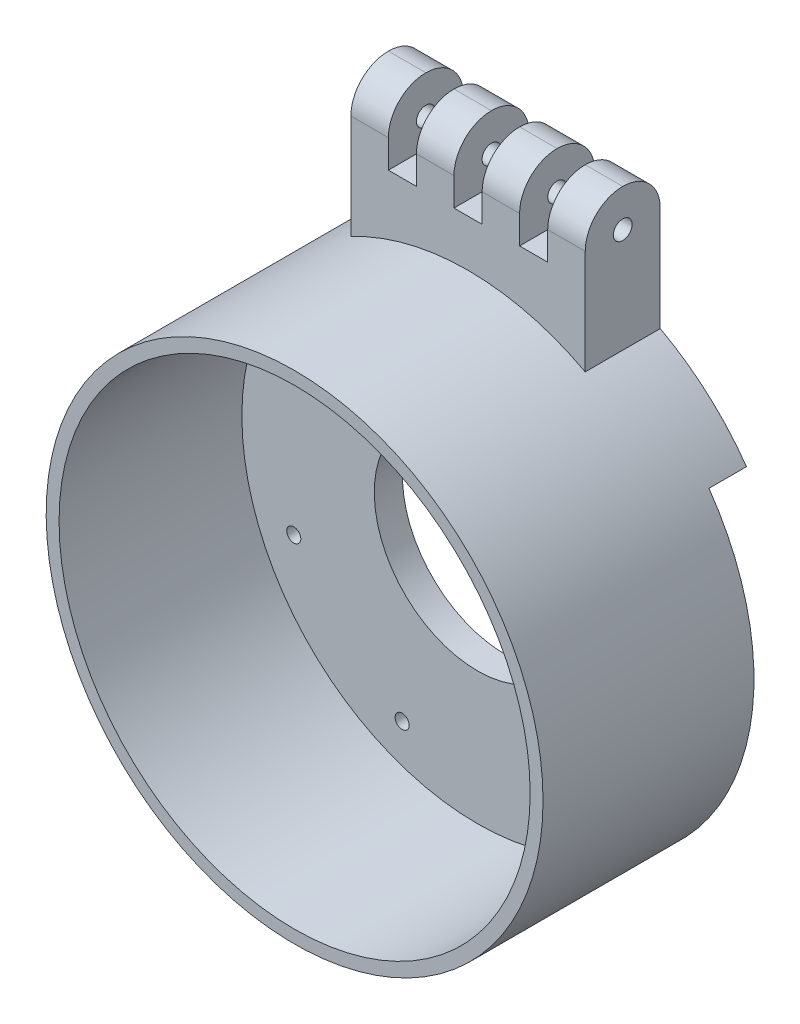
from build123d import *

# Parameters (mm, degrees)
SKETCH1_R               = 53
BOSS_EXTRUDE2_DEPTH     = 45
SKETCH2_R               = 50.25
CUT_EXTRUDE1_DEPTH      = 39
SKETCH4_R               = 22
CUT_EXTRUDE3_DEPTH      = 39
BOSS_EXTRUDE3_START     = 8
BOSS_EXTRUDE3_DEPTH     = 8
CUT_EXTRUDE5_DEPTH      = 10
CUT_EXTRUDE5_DEPTH_BACK = 10
SKETCH10_R              = 1.5
BOSS_EXTRUDE6_START     = -8
BOSS_EXTRUDE6_DEPTH     = 16
SKETCH13_W              = 8
SKETCH13_H              = 16
BOSS_EXTRUDE7_DEPTH     = 14
FILLET1_R               = 8
LPATTERN1_COUNT         = 4
LPATTERN1_PITCH         = 14
FILLET1_OF_LPATTERN1_R  = 8
CUT_EXTRUDE6_DEPTH      = 119.482066153
CUT_EXTRUDE6_DEPTH_BACK = 119.482066153
SKETCH14_R              = 2


# Read off the part's stored shape, not the designer's step: Boss-Extrude6
with BuildPart() as part:
    # Sketch1 → Boss-Extrude2 (new body)
    with BuildSketch(Plane.XY):
        with Locations(Location((0, 0, 0), (0, 0, 180))):
            Circle(SKETCH1_R)
    extrude(amount=BOSS_EXTRUDE2_DEPTH)

    # Sketch2 → Cut-Extrude1 (cut)
    with BuildSketch(Plane.XY.offset(45)):
        Circle(SKETCH2_R)
    extrude(amount=-CUT_EXTRUDE1_DEPTH, mode=Mode.SUBTRACT)

    # Sketch4 → Cut-Extrude3 (cut)
    with BuildSketch(Plane(origin=(0, 0, 0), x_dir=(-1, 0, 0), z_dir=(0, 0, -1))):
        Circle(SKETCH4_R)
    extrude(amount=-CUT_EXTRUDE3_DEPTH, mode=Mode.SUBTRACT)

    # Sketch5 → Boss-Extrude3 (add)
    with BuildSketch(Plane(origin=(0, 0, 0), x_dir=(-1, 0, 0), z_dir=(0, 0, -1)).offset(BOSS_EXTRUDE3_START)):
        with BuildLine():
            Line((19.052558883, 11), (51.845925587, 11))
            ThreePointArc((51.845925587, 11), (10.588828865, 51.931461594), (-43.400241675, 30.42070056))
            Line((-43.400241675, 30.42070056), (-16.397830673, 14.666667965))
            ThreePointArc((-16.397830673, 14.666667965), (2.263406494, 21.883258236), (19.052558883, 11))
        make_face()
    extrude(amount=-BOSS_EXTRUDE3_DEPTH)

    # Sketch10 → Cut-Extrude5 (cut, two sides: drawn at the far end of the back side and taken through both)
    with BuildSketch(Plane(origin=(0, 0, 0), x_dir=(-1, 0, 0), z_dir=(0, 0, -1)).offset(-CUT_EXTRUDE5_DEPTH_BACK)):
        with Locations(Location((-39.35, -16.057007816, 0), (0, 0, 180))):
            Circle(SKETCH10_R)
        with Locations(Location((-39.178670952, 16.470632727, 0), (0, 0, 180))):
            Circle(SKETCH10_R)
        with Locations(Location((-16.057007816, 39.35, 0), (0, 0, 180))):
            Circle(SKETCH10_R)
        with Locations(Location((16.470632727, 39.178670952, 0), (0, 0, 180))):
            Circle(SKETCH10_R)
        with Locations(Location((39.35, 16.057007816, 0), (0, 0, 180))):
            Circle(SKETCH10_R)
        with Locations(Location((39.178670952, -16.470632727, 0), (0, 0, 180))):
            Circle(SKETCH10_R)
        with Locations(Location((16.057007816, -39.35, 0), (0, 0, 180))):
            Circle(SKETCH10_R)
        with Locations(Location((-16.470632728, -39.178670952, 0), (0, 0, 180))):
            Circle(SKETCH10_R)
    extrude(amount=CUT_EXTRUDE5_DEPTH + CUT_EXTRUDE5_DEPTH_BACK, mode=Mode.SUBTRACT)

    # Boss-Extrude6 outline → Boss-Extrude6 (add)
    with BuildSketch(Plane.XY.offset(BOSS_EXTRUDE6_START)):
        with BuildLine():
            Line((-25, 63), (-25, 46.733285782))
            ThreePointArc((-25, 46.733285782), (0, 53), (25, 46.733285782))
            Line((25, 46.733285782), (25, 63))
            Line((25, 63), (-25, 63))
        make_face()
    extrude(amount=BOSS_EXTRUDE6_DEPTH)

    # Sketch13 → Boss-Extrude7 (add)
    with BuildSketch(Plane(origin=(0, 63, 0), x_dir=(1, 0, 0), z_dir=(0, 1, 0))):
        with Locations((21, 0)):
            Rectangle(SKETCH13_W, SKETCH13_H)
    boss_extrude7 = extrude(amount=BOSS_EXTRUDE7_DEPTH)

    # Fillet1
    fillet1_edges = [part.edges().sort_by_distance(p)[0] for p in [
        (21, 77, 8),
        (21, 77, -8),
    ]]
    fillet(fillet1_edges, radius=FILLET1_R - 0.0001)  # a hair under: the kernel refuses the full size

    # LPattern1: Boss-Extrude7 ×4
    with Locations(*[(-i * LPATTERN1_PITCH, 0, 0) for i in range(1, LPATTERN1_COUNT)]):
        add(boss_extrude7)

    # Fillet1 of LPattern1
    fillet1_of_lpattern1_edges = [part.edges().sort_by_distance(p)[0] for p in [
        (7, 77, 8),
        (7, 77, -8),
        (-7, 77, 8),
        (-7, 77, -8),
        (-21, 77, 8),
        (-21, 77, -8),
    ]]
    fillet(fillet1_of_lpattern1_edges, radius=FILLET1_OF_LPATTERN1_R - 0.0001)  # a hair under: the kernel refuses the full size

    # Sketch14 → Cut-Extrude6 (cut, two sides: drawn at the far end of the back side and taken through both)
    with BuildSketch(Plane(origin=(25, 0, 0), x_dir=(0, 0, -1), z_dir=(1, 0, 0)).offset(-CUT_EXTRUDE6_DEPTH_BACK)):
        with Locations((0, 69)):
            Circle(SKETCH14_R)
    extrude(amount=CUT_EXTRUDE6_DEPTH + CUT_EXTRUDE6_DEPTH_BACK, mode=Mode.SUBTRACT)


solid = part.part
